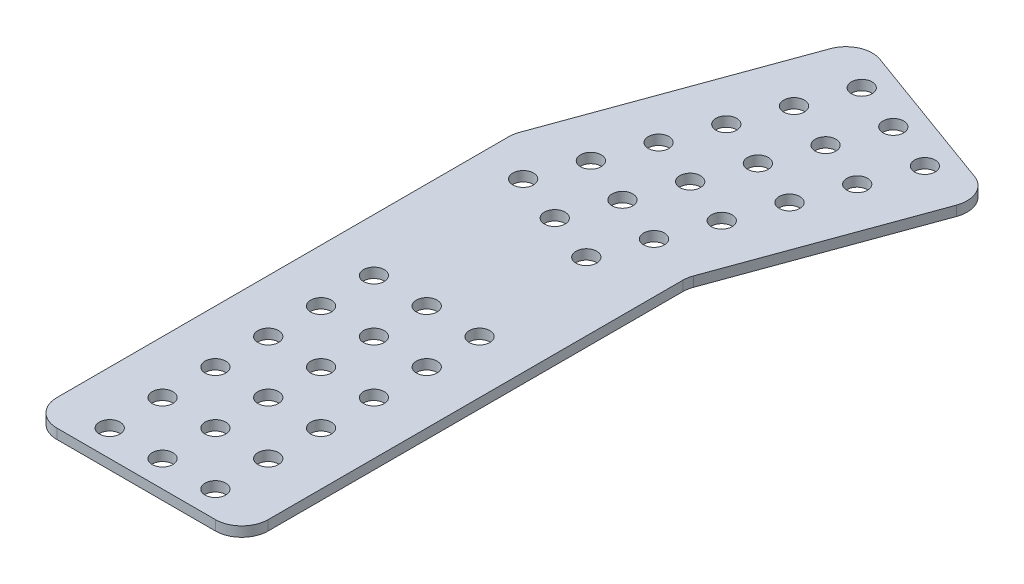
from build123d import *

# Parameters (mm, degrees)
SKETCH1_R           = 2.4892
BOSS_EXTRUDE1_DEPTH = 2.38125
FILLET1_R           = 6.35


with BuildPart() as part:
    # Sketch1 → Boss-Extrude1 (new body)
    with BuildSketch(Plane(origin=(0, 0, 0), x_dir=(1, 0, 0), z_dir=(0, 1, 0))):
        Polygon((-73.745518613, -384.005622456), (-73.745518613, -276.87877894), (-54.317612196, -223.501044752), (-102.053997332, -206.126421471), (-124.545518613, -267.92136832), (-124.545518613, -384.005622456), align=None)
        with Locations((-111.845518613, -377.655622456)):
            Circle(SKETCH1_R, mode=Mode.SUBTRACT)
        with Locations((-111.845518613, -364.955622456)):
            Circle(SKETCH1_R, mode=Mode.SUBTRACT)
        with Locations((-111.845518613, -352.255622456)):
            Circle(SKETCH1_R, mode=Mode.SUBTRACT)
        with Locations((-111.845518613, -339.555622456)):
            Circle(SKETCH1_R, mode=Mode.SUBTRACT)
        with Locations((-99.145518613, -377.655622456)):
            Circle(SKETCH1_R, mode=Mode.SUBTRACT)
        with Locations((-99.145518613, -364.955622456)):
            Circle(SKETCH1_R, mode=Mode.SUBTRACT)
        with Locations((-99.145518613, -352.255622456)):
            Circle(SKETCH1_R, mode=Mode.SUBTRACT)
        with Locations((-99.145518613, -339.555622456)):
            Circle(SKETCH1_R, mode=Mode.SUBTRACT)
        with Locations((-111.845518613, -326.855622456)):
            Circle(SKETCH1_R, mode=Mode.SUBTRACT)
        with Locations((-111.845518613, -314.155622456)):
            Circle(SKETCH1_R, mode=Mode.SUBTRACT)
        with Locations((-99.145518613, -326.855622456)):
            Circle(SKETCH1_R, mode=Mode.SUBTRACT)
        with Locations((-99.145518613, -314.155622456)):
            Circle(SKETCH1_R, mode=Mode.SUBTRACT)
        with Locations((-86.445518613, -377.655622456)):
            Circle(SKETCH1_R, mode=Mode.SUBTRACT)
        with Locations((-86.445518613, -364.955622456)):
            Circle(SKETCH1_R, mode=Mode.SUBTRACT)
        with Locations((-86.445518613, -352.255622456)):
            Circle(SKETCH1_R, mode=Mode.SUBTRACT)
        with Locations((-86.445518613, -339.555622456)):
            Circle(SKETCH1_R, mode=Mode.SUBTRACT)
        with Locations((-86.445518613, -326.855622456)):
            Circle(SKETCH1_R, mode=Mode.SUBTRACT)
        with Locations((-86.445518613, -314.155622456)):
            Circle(SKETCH1_R, mode=Mode.SUBTRACT)
        with Locations((-90.141815492, -284.794918494)):
            Circle(SKETCH1_R, mode=Mode.SUBTRACT)
        with Locations((-114.01000806, -276.107606853)):
            Circle(SKETCH1_R, mode=Mode.SUBTRACT)
        with Locations((-102.075911776, -280.451262674)):
            Circle(SKETCH1_R, mode=Mode.SUBTRACT)
        with Locations((-68.42353639, -225.124437074)):
            Circle(SKETCH1_R, mode=Mode.SUBTRACT)
        with Locations((-109.666352239, -264.173510569)):
            Circle(SKETCH1_R, mode=Mode.SUBTRACT)
        with Locations((-105.322696419, -252.239414285)):
            Circle(SKETCH1_R, mode=Mode.SUBTRACT)
        with Locations((-97.732255955, -268.51716639)):
            Circle(SKETCH1_R, mode=Mode.SUBTRACT)
        with Locations((-93.388600135, -256.583070106)):
            Circle(SKETCH1_R, mode=Mode.SUBTRACT)
        with Locations((-100.979040599, -240.305318001)):
            Circle(SKETCH1_R, mode=Mode.SUBTRACT)
        with Locations((-96.635384779, -228.371221717)):
            Circle(SKETCH1_R, mode=Mode.SUBTRACT)
        with Locations((-92.291728958, -216.437125433)):
            Circle(SKETCH1_R, mode=Mode.SUBTRACT)
        with Locations((-85.798159671, -272.86082221)):
            Circle(SKETCH1_R, mode=Mode.SUBTRACT)
        with Locations((-81.454503851, -260.926725926)):
            Circle(SKETCH1_R, mode=Mode.SUBTRACT)
        with Locations((-89.044944315, -244.648973822)):
            Circle(SKETCH1_R, mode=Mode.SUBTRACT)
        with Locations((-84.701288495, -232.714877538)):
            Circle(SKETCH1_R, mode=Mode.SUBTRACT)
        with Locations((-77.110848031, -248.992629642)):
            Circle(SKETCH1_R, mode=Mode.SUBTRACT)
        with Locations((-72.767192211, -237.058533358)):
            Circle(SKETCH1_R, mode=Mode.SUBTRACT)
        with Locations((-80.357632674, -220.780781254)):
            Circle(SKETCH1_R, mode=Mode.SUBTRACT)
    extrude(amount=BOSS_EXTRUDE1_DEPTH)

    # Fillet1
    fillet1_edges = [part.edges().sort_by_distance(p)[0] for p in [
        (-54.317612196, 1.190625, 223.501044752),
        (-102.053997332, 1.190625, 206.126421471),
        (-124.545518613, 1.190625, 267.92136832),
        (-73.745518613, 1.190625, 276.87877894),
        (-73.745518613, 1.190625, 384.005622456),
        (-124.545518613, 1.190625, 384.005622456),
    ]]
    fillet(fillet1_edges, radius=FILLET1_R)


solid = part.part
